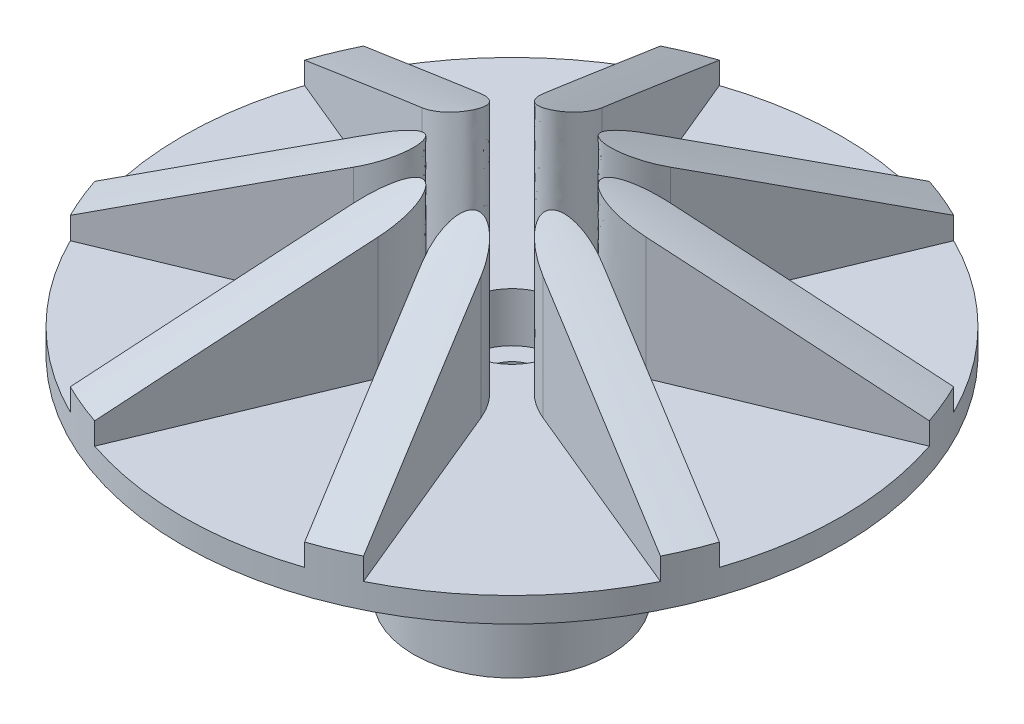
from build123d import *
from build123d.topology import SkipClean

# Parameters (mm, degrees)
SKETCH1_R                       = 26.6319
IMPELLER_PLATE_DEPTH            = 2.000000064
SKETCH6_R                       = 7.9375
BOSS_DEPTH                      = 17.000000036
SKETCH7_R                       = 2.1828125
BOLT_BORE_DEPTH                 = 43.184312238
SKETCH8_R                       = 4
SHAFT_BORE_DEPTH                = 11.999999876
SKETCH9_R                       = 3.75
BOLT_HEAD_BORE_DEPTH            = 4.000000128
SKETCH11_W                      = 12.00000013
SKETCH11_H                      = 2.000000064
DOWEL_SLOT_DEPTH                = 3.000000096
OPENING_START                   = -1
OPENING_ALINGMENT_CUT_DEPTH     = 1
OPENING_ALINGMENT_PATTERN_COUNT = 8
ONE_BLADE_DEPTH                 = 11.673841229
OPENING_START_2                 = -2.000000064
SKETCH15_R                      = 26.6319
SKETCH15_R_2                    = 3.75
OPENING_ALIGNMENT_FILL_DEPTH    = 2.000000064
CIRPATTERN2_COUNT               = 8


with BuildPart() as part:
    # Sketch1 → impeller plate (new body)
    with BuildSketch(Plane(origin=(0, 0, 0), x_dir=(1, 0, 0), z_dir=(0, 1, 0))):
        Circle(SKETCH1_R)
    extrude(amount=IMPELLER_PLATE_DEPTH)

    # Sketch6 → boss (add)
    with BuildSketch(Plane(origin=(0, 0, 0), x_dir=(-1, 0, 0), z_dir=(0, -1, 0))):
        Circle(SKETCH6_R)
    extrude(amount=BOSS_DEPTH)

    # Sketch7 → bolt bore (cut, through all)
    with BuildSketch(Plane(origin=(0, -17.000000036, 0), x_dir=(-1, 0, 0), z_dir=(0, -1, 0))):
        Circle(SKETCH7_R)
    extrude(amount=-BOLT_BORE_DEPTH, mode=Mode.SUBTRACT)

    # Sketch8 → shaft bore (cut)
    with BuildSketch(Plane(origin=(0, -17.000000036, 0), x_dir=(-1, 0, 0), z_dir=(0, -1, 0))):
        Circle(SKETCH8_R)
    extrude(amount=-SHAFT_BORE_DEPTH, mode=Mode.SUBTRACT)

    # Sketch9 → bolt head bore (cut)
    with BuildSketch(Plane(origin=(0, 2.000000064, 0), x_dir=(1, 0, 0), z_dir=(0, 1, 0))):
        Circle(SKETCH9_R)
    extrude(amount=-BOLT_HEAD_BORE_DEPTH, mode=Mode.SUBTRACT)

    # Sketch11 → dowel slot (cut)
    with BuildSketch(Plane.XZ.offset(17.000000036)):
        Rectangle(SKETCH11_W, SKETCH11_H)
    extrude(amount=-DOWEL_SLOT_DEPTH, mode=Mode.SUBTRACT)

    # Sketch12 → opening alingment cut (cut)
    with BuildSketch(Plane(origin=(0, 2.000000064, 0), x_dir=(1, 0, 0), z_dir=(0, 1, 0)).offset(OPENING_START)):
        with BuildLine():
            Line((5.256755524, 1.279369141), (26.60115246, 1.279369141))
            ThreePointArc((26.60115246, 1.279369141), (26.6319, 0), (26.60115246, -1.279369141))
            Line((26.60115246, -1.279369141), (5.256755524, -1.279369141))
            ThreePointArc((5.256755524, -1.279369141), (5.4102, 0), (5.256755524, 1.279369141))
        make_face()
    opening_alingment_cut = extrude(amount=OPENING_ALINGMENT_CUT_DEPTH, mode=Mode.SUBTRACT)

    # opening alingment pattern: opening alingment cut ×8 about axis
    opening_alingment_pattern_axis = Axis((0, 2.000000064, 0), (0, 1, 0))
    for i in range(1, OPENING_ALINGMENT_PATTERN_COUNT):
        add(opening_alingment_cut.rotate(opening_alingment_pattern_axis, i * 360 / OPENING_ALINGMENT_PATTERN_COUNT), mode=Mode.SUBTRACT)

    # Sketch14 → one blade (add)
    with SkipClean():  # the faces are left unmerged after this step: merging them gives an invalid solid
        with BuildSketch(Plane(origin=(0, 2.000000064, 0), x_dir=(1, 0, 0), z_dir=(0, 1, 0))):
            with BuildLine():
                Line((7.666474064, 5.146740226), (23.850155131, 11.850240413))
                ThreePointArc((23.850155131, 11.850240413), (24.604667322, 10.191586902), (25.24399178, 8.485221071))
                Line((25.24399178, 8.485221071), (9.060310713, 1.781720884))
                add(Edge.make_bspline(
                    [(7.666474064, 5.146740226), (4.301454722, 3.752903577), (4.998373047, 2.070393906), (5.695291371, 0.387884235), (9.060310713, 1.781720884)],
                    knots=[4.71238898, 4.71238898, 4.71238898, 6.283185307, 6.283185307, 7.853981634, 7.853981634, 7.853981634], degree=2, weights=[1, 0.707106781, 1, 0.707106781, 1]))
            make_face()
        one_blade = extrude(amount=ONE_BLADE_DEPTH)

    # Sketch15 → opening alignment fill (add)
    with SkipClean():  # the faces are left unmerged after this step: merging them gives an invalid solid
        with BuildSketch(Plane(origin=(0, 2.000000064, 0), x_dir=(1, 0, 0), z_dir=(0, 1, 0)).offset(OPENING_START_2)):
            Circle(SKETCH15_R)
            Circle(SKETCH15_R_2, mode=Mode.SUBTRACT)
        extrude(amount=OPENING_ALIGNMENT_FILL_DEPTH)

    # CirPattern2: one blade ×8 about axis
    with SkipClean():  # the faces are left unmerged after this step: merging them gives an invalid solid
        cirpattern2_axis = Axis((0, 2.000000064, 0), (0, 1, 0))
        for i in range(1, CIRPATTERN2_COUNT):
            add(one_blade.rotate(cirpattern2_axis, i * 360 / CIRPATTERN2_COUNT))

    # Sketch16 → angle cut (revolve, cut)
    with SkipClean():  # the faces are left unmerged after this step: merging them gives an invalid solid
        with BuildSketch(Plane(origin=(0, 0, 0), x_dir=(0, 0, -1), z_dir=(1, 0, 0))):
            Polygon((5.4102, 13.673841293), (26.6319, 3.778000064), (26.6319, 13.673841293), align=None)
        revolve(axis=Axis((0, 0, 0), (0, 1, 0)), mode=Mode.SUBTRACT)


solid = part.part
